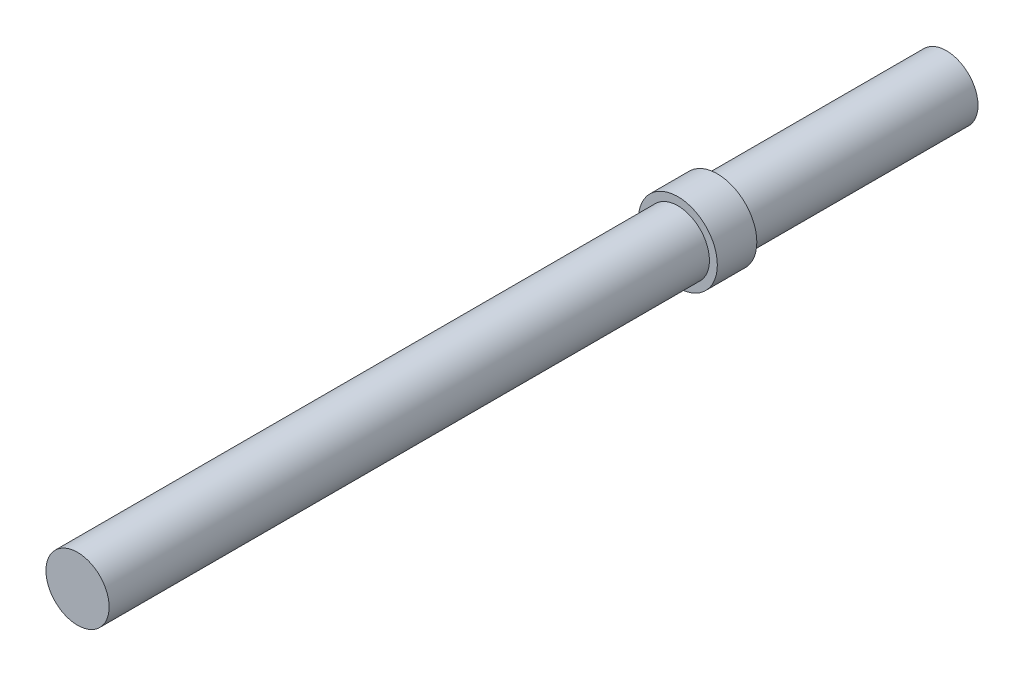
from build123d import *

# Parameters (mm, degrees)
CROQUIS1_R              = 4
SALIENTE_EXTRUIR1_DEPTH = 55
CROQUIS2_R              = 5
SALIENTE_EXTRUIR2_DEPTH = 5


with BuildPart() as part:
    # Croquis1 → Saliente-Extruir1 (new, symmetric)
    with BuildSketch(Plane.XY):
        Circle(CROQUIS1_R)
    extrude(amount=SALIENTE_EXTRUIR1_DEPTH, both=True)

    # Croquis2 → Saliente-Extruir2 (add)
    with BuildSketch(Plane.XY.offset(-26)):
        Circle(CROQUIS2_R)
    extrude(amount=SALIENTE_EXTRUIR2_DEPTH)


solid = part.part
